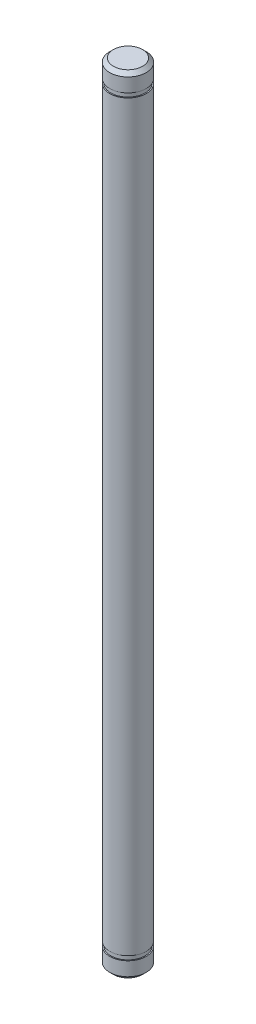
from build123d import *

# Parameters (mm, degrees)
SKETCH_1_R          = 2.5
EXTRUDE_1_DEPTH     = 108
CHAMFER_1_SIZE      = 0.5
CUT_EXTRUDE_START   = -3
SKETCH_2_R          = 2.5
SKETCH_2_R_2        = 2.35
CUT_EXTRUDE_1_DEPTH = 0.6


with BuildPart() as part:
    # 草图1 → 凸台-拉伸1 (new body)
    with BuildSketch(Plane(origin=(0, 0, 0), x_dir=(1, 0, 0), z_dir=(0, 1, 0))):
        Circle(SKETCH_1_R)
    extrude(amount=EXTRUDE_1_DEPTH)

    # 倒角1
    chamfer_1_edges = [part.edges().sort_by_distance(p)[0] for p in [
        (-2.5, 0, 0),
        (-2.5, 108, 0),
    ]]
    chamfer(chamfer_1_edges, length=CHAMFER_1_SIZE)

    # 草图2 → 切除-拉伸1 (cut)
    with BuildSketch(Plane(origin=(0, 108, 0), x_dir=(1, 0, 0), z_dir=(0, 1, 0)).offset(CUT_EXTRUDE_START)):
        Circle(SKETCH_2_R)
        Circle(SKETCH_2_R_2, mode=Mode.SUBTRACT)
    cut_extrude_1 = extrude(amount=CUT_EXTRUDE_1_DEPTH, mode=Mode.SUBTRACT)

    # 镜向1: 切除-拉伸1 across plane
    add(cut_extrude_1.mirror(Plane.ZX.offset(54)), mode=Mode.SUBTRACT)


solid = part.part
